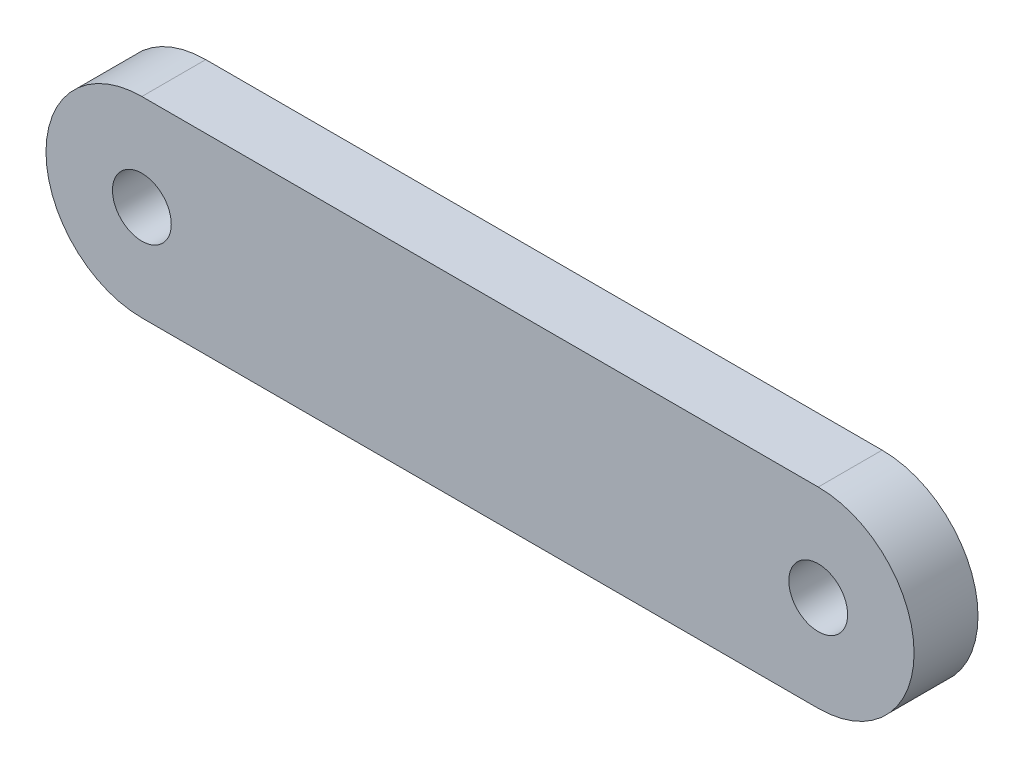
from build123d import *

# Parameters (mm, degrees)
SKETCH_1_R      = 2.3
EXTRUDE_1_DEPTH = 5


with BuildPart() as part:
    # 草图1 → 凸台-拉伸1 (new body)
    with BuildSketch(Plane.XY):
        with BuildLine():
            Line((-26.46, 7.5), (26.46, 7.5))
            ThreePointArc((26.46, 7.5), (33.96, 0), (26.46, -7.5))
            Line((26.46, -7.5), (-26.46, -7.5))
            ThreePointArc((-26.46, -7.5), (-33.96, 0), (-26.46, 7.5))
        make_face()
        with Locations((-26.46, 0)):
            Circle(SKETCH_1_R, mode=Mode.SUBTRACT)
        with Locations((26.46, 0)):
            Circle(SKETCH_1_R, mode=Mode.SUBTRACT)
    extrude(amount=EXTRUDE_1_DEPTH)


solid = part.part
